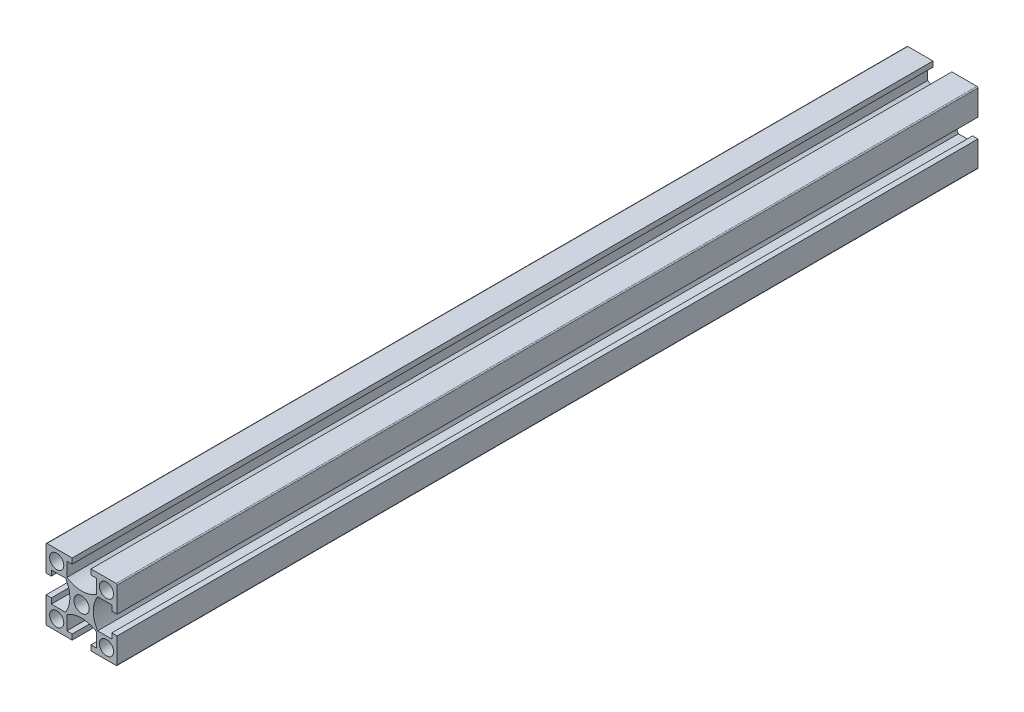
from build123d import *

# Parameters (mm, degrees)
SKETCH_1_W               = 20
SKETCH_1_H               = 20
SKETCH_1_R               = 2
SKETCH_1_R_2             = 2.15
EXTRUDE_1_DEPTH          = 242
CUT_EXTRUDE_1_REACH      = 244.413
PATTERN_CIRCULAR_1_COUNT = 4
FILLET_1_R               = 0.3
SKETCH_2_R               = 2.5
CUT_EXTRUDE_2_DEPTH      = 244.030862238


with BuildPart() as part:
    # 스케치1 → 보스-돌출1 (new body)
    with BuildSketch(Plane.XY):
        Rectangle(SKETCH_1_W, SKETCH_1_H)
        with Locations((-7, -7)):
            Circle(SKETCH_1_R, mode=Mode.SUBTRACT)
        with Locations((7, -7)):
            Circle(SKETCH_1_R, mode=Mode.SUBTRACT)
        with Locations((-7, 7)):
            Circle(SKETCH_1_R, mode=Mode.SUBTRACT)
        Circle(SKETCH_1_R_2, mode=Mode.SUBTRACT)
        with Locations((7, 7)):
            Circle(SKETCH_1_R, mode=Mode.SUBTRACT)
    extrude(amount=EXTRUDE_1_DEPTH)

    # 스케치1<3> → 컷-돌출1 (cut, up to next)
    with BuildSketch(Plane.XY, mode=Mode.PRIVATE) as cut_extrude_1_sk1:
        with BuildLine():
            Line((-8.5, 2.65), (-10, 2.65))
            Line((-10, 2.65), (-10, -2.65))
            Line((-10, -2.65), (-8.5, -2.65))
            Line((-8.5, -2.65), (-8.5, -4.15))
            Line((-8.5, -4.15), (-4.503166667, -4.15))
            ThreePointArc((-4.503166667, -4.15), (-3.3, 0), (-4.503166667, 4.15))
            Line((-4.503166667, 4.15), (-8.5, 4.15))
            Line((-8.5, 4.15), (-8.5, 2.65))
        make_face()
    cut_extrude_1_tool1 = extrude(cut_extrude_1_sk1.sketch, amount=CUT_EXTRUDE_1_REACH, mode=Mode.PRIVATE) & part.part
    cut_extrude_1 = cut_extrude_1_tool1.solids().sort_by_distance((-6.606913, 0, 0))[0]
    add(cut_extrude_1, mode=Mode.SUBTRACT)

    # 원형 패턴1: 컷-돌출1 ×4 about axis
    pattern_circular_1_axis = Axis((0, 0, 242), (0, 0, -1))
    for i in range(1, PATTERN_CIRCULAR_1_COUNT):
        add(cut_extrude_1.rotate(pattern_circular_1_axis, i * 360 / PATTERN_CIRCULAR_1_COUNT), mode=Mode.SUBTRACT)

    # 필렛1
    fillet_1_edges = [part.edges().sort_by_distance(p)[0] for p in [
        (10, -10, 121),
        (-10, -10, 121),
        (-10, 10, 121),
        (10, 10, 121),
    ]]
    fillet(fillet_1_edges, radius=FILLET_1_R)

    # 스케치2 → 컷-돌출2 (cut, through all)
    with BuildSketch(Plane(origin=(0, 10, 0), x_dir=(1, 0, 0), z_dir=(0, 1, 0))):
        with Locations((0, -215)):
            Circle(SKETCH_2_R)
        with Locations((0, -10)):
            Circle(SKETCH_2_R)
        with Locations((0, -186)):
            Circle(SKETCH_2_R)
    extrude(amount=-CUT_EXTRUDE_2_DEPTH, mode=Mode.SUBTRACT)


solid = part.part
